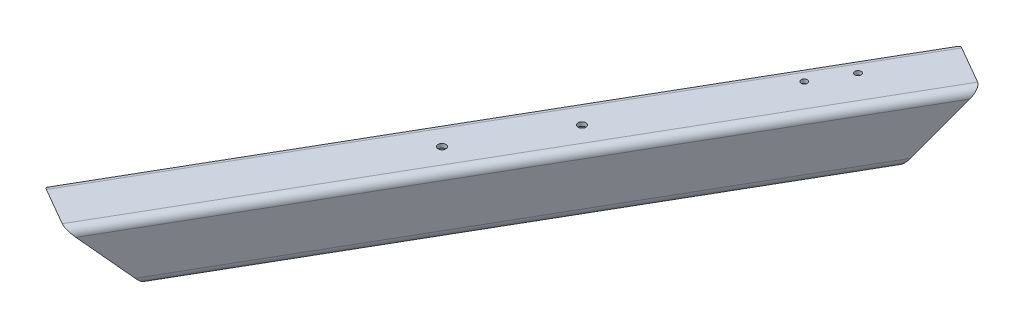
from build123d import *

# Parameters (mm, degrees)
CUT_EXTRUDE_1_DEPTH      = 255.214775441
CUT_EXTRUDE_1_DEPTH_BACK = 255.214775441
SKETCH_3_R               = 2
CUT_EXTRUDE_2_DEPTH      = 227.974238286
CUT_EXTRUDE_3_REACH      = 225.975
SKETCH_6_R               = 1.6


with BuildPart() as part:
    # 扫描1: sweep along a path in 草图1
    with BuildLine(Plane(origin=(0, 0, 0), x_dir=(1, 0, 0), z_dir=(0, 1, 0))) as sweep_1_path:
        Line((-39, 22.516660498), (61, 195.721741255))
    # 草图2 → 扫描1 (sweep)
    with BuildSketch(Plane(origin=(-39, 0, -22.516660498), x_dir=(0.8660254037844388, 0, 0.4999999999999997), z_dir=(-0.49999999999999983, 0, 0.8660254037844389))):
        with BuildLine():
            Line((-11, -15), (11, -15))
            ThreePointArc((11, -15), (13.828427125, -13.828427125), (15, -11))
            Line((15, -11), (15, 11))
            ThreePointArc((15, 11), (13.828427125, 13.828427125), (11, 15))
            Line((11, 15), (-11, 15))
            ThreePointArc((-11, 15), (-13.828427125, 13.828427125), (-15, 11))
            Line((-15, 11), (-15, -11))
            ThreePointArc((-15, -11), (-13.828427125, -13.828427125), (-11, -15))
        make_face()
        with BuildLine():
            Line((-11, -13), (11, -13))
            ThreePointArc((11, -13), (12.414213562, -12.414213562), (13, -11))
            Line((13, -11), (13, 11))
            ThreePointArc((13, 11), (12.414213562, 12.414213562), (11, 13))
            Line((11, 13), (-11, 13))
            ThreePointArc((-11, 13), (-12.414213562, 12.414213562), (-13, 11))
            Line((-13, 11), (-13, -11))
            ThreePointArc((-13, -11), (-12.414213562, -12.414213562), (-11, -13))
        make_face(mode=Mode.SUBTRACT)
    sweep_1 = sweep(path=sweep_1_path.line)

    # 镜向1: 扫描1 across plane
    add(sweep_1.mirror(Plane(origin=(-39, 0, -22.516660498), x_dir=(0.866025403784439, 0, 0.4999999999999994), z_dir=(-0.49999999999999983, 0, 0.8660254037844389))))

    # 草图3 → 切除-拉伸1 (cut, two sides: drawn at the far end of the back side and taken through both)
    with BuildSketch(Plane(origin=(0, 0, 0), x_dir=(1, 0, 0), z_dir=(0, 1, 0)).offset(-CUT_EXTRUDE_1_DEPTH_BACK)):
        with Locations((-26, 45.033320997)):
            Circle(SKETCH_3_R)
        with Locations((-52, 0)):
            Circle(SKETCH_3_R)
    extrude(amount=CUT_EXTRUDE_1_DEPTH + CUT_EXTRUDE_1_DEPTH_BACK, mode=Mode.SUBTRACT)

    # 草图5 → 切除-拉伸2 (cut, through all)
    with BuildSketch(Plane(origin=(-26.009618943, 0, -15.016660498), x_dir=(0.4999999999999999, 0, -0.8660254037844386), z_dir=(0.8660254037844387, 0, 0.49999999999999994))):
        Polygon((-200, -15), (-140, -15), (-170, 15), (-200, 15), align=None)
        Polygon((200, 15), (200, -15), (140, -15), (170, 15), align=None)
    extrude(amount=-CUT_EXTRUDE_2_DEPTH, mode=Mode.SUBTRACT)

    # 草图6 → 切除-拉伸3 (cut, up to next)
    with BuildSketch(Plane(origin=(0, 15, 0), x_dir=(1, 0, 0), z_dir=(0, 1, 0)), mode=Mode.PRIVATE) as cut_extrude_3_sk1:
        with Locations((11.262841041, 120.514454915)):
            Circle(SKETCH_6_R)
    cut_extrude_3_tool1 = extrude(cut_extrude_3_sk1.sketch, amount=-CUT_EXTRUDE_3_REACH, mode=Mode.PRIVATE) & part.part
    # 草图6 → 切除-拉伸3 (cut, up to next)
    with BuildSketch(Plane(origin=(0, 15, 0), x_dir=(1, 0, 0), z_dir=(0, 1, 0)), mode=Mode.PRIVATE) as cut_extrude_3_sk2:
        with Locations((21.262841041, 137.83496299)):
            Circle(SKETCH_6_R)
    cut_extrude_3_tool2 = extrude(cut_extrude_3_sk2.sketch, amount=-CUT_EXTRUDE_3_REACH, mode=Mode.PRIVATE) & part.part
    add(cut_extrude_3_tool1.solids().sort_by_distance((11.262841, 15, -120.514455))[0], mode=Mode.SUBTRACT)
    add(cut_extrude_3_tool2.solids().sort_by_distance((21.262841, 15, -137.834963))[0], mode=Mode.SUBTRACT)


solid = part.part
